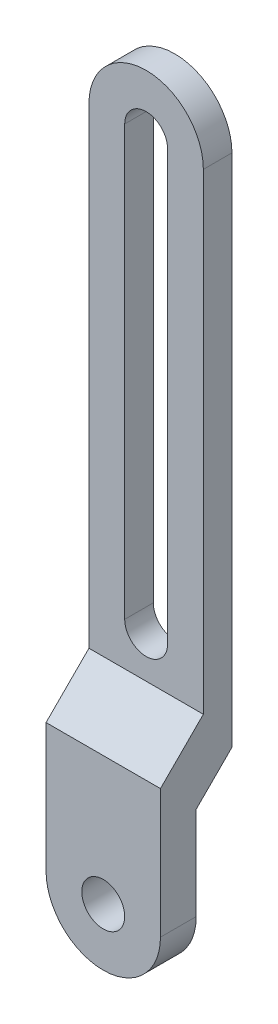
from build123d import *

# Parameters (mm, degrees)
SZKIC1_R                    = 1.5
DODANIE_WYCI_GNI_CIE1_DEPTH = 2
SZKIC2_R                    = 1.5
DODANIE_WYCI_GNI_CIE2_DEPTH = 3
WYTNIJ_WYCI_GNI_CIE1_DEPTH  = 2.5
SFAZOWANIE1_SIZE            = 3
SFAZOWANIE2_SIZE            = 2
SFAZOWANIE3_SIZE            = 0.5


with BuildPart() as part:
    # Szkic1 → Dodanie-wyciągnięcie1 (new body)
    with BuildSketch(Plane.XY):
        with BuildLine():
            Line((-4, 0), (-4, 45))
            ThreePointArc((-4, 45), (0, 49), (4, 45))
            Line((4, 45), (4, 0))
            ThreePointArc((4, 0), (0, -4), (-4, 0))
        make_face()
        Circle(SZKIC1_R, mode=Mode.SUBTRACT)
        with BuildLine():
            Line((1.5, 45), (1.5, 15))
            ThreePointArc((1.5, 15), (0, 13.5), (-1.5, 15))
            Line((-1.5, 15), (-1.5, 45))
            ThreePointArc((-1.5, 45), (0, 46.5), (1.5, 45))
        make_face(mode=Mode.SUBTRACT)
    extrude(amount=DODANIE_WYCI_GNI_CIE1_DEPTH)

    # Szkic2 → Dodanie-wyciągnięcie2 (add)
    with BuildSketch(Plane.XY.offset(2)):
        with BuildLine():
            Line((-4, 9), (4, 9))
            Line((4, 9), (4, 0))
            ThreePointArc((4, 0), (0, -4), (-4, 0))
            Line((-4, 0), (-4, 9))
        make_face()
        Circle(SZKIC2_R, mode=Mode.SUBTRACT)
    extrude(amount=DODANIE_WYCI_GNI_CIE2_DEPTH)

    # Szkic3 → Wytnij-wyciągnięcie1 (cut)
    with BuildSketch(Plane(origin=(0, 0, 0), x_dir=(-1, 0, 0), z_dir=(0, 0, -1))):
        with BuildLine():
            Line((-4, 7), (4, 7))
            Line((4, 7), (4, 0))
            ThreePointArc((4, 0), (0, -4), (-4, 0))
            Line((-4, 0), (-4, 7))
        make_face()
    extrude(amount=-WYTNIJ_WYCI_GNI_CIE1_DEPTH, mode=Mode.SUBTRACT)

    # Sfazowanie1
    sfazowanie1_edges = [part.edges().sort_by_distance(p)[0] for p in [
        (0, 9, 2),
    ]]
    chamfer(sfazowanie1_edges, length=SFAZOWANIE1_SIZE - 0.0001)  # a hair under: the kernel refuses the full size

    # Sfazowanie2
    sfazowanie2_edges = [part.edges().sort_by_distance(p)[0] for p in [
        (0, 7, 0),
    ]]
    chamfer(sfazowanie2_edges, length=SFAZOWANIE2_SIZE)

    # Sfazowanie3
    sfazowanie3_edges = [part.edges().sort_by_distance(p)[0] for p in [
        (0, 7, 2.5),
    ]]
    chamfer(sfazowanie3_edges, length=SFAZOWANIE3_SIZE - 0.0001)  # a hair under: the kernel refuses the full size


solid = part.part
